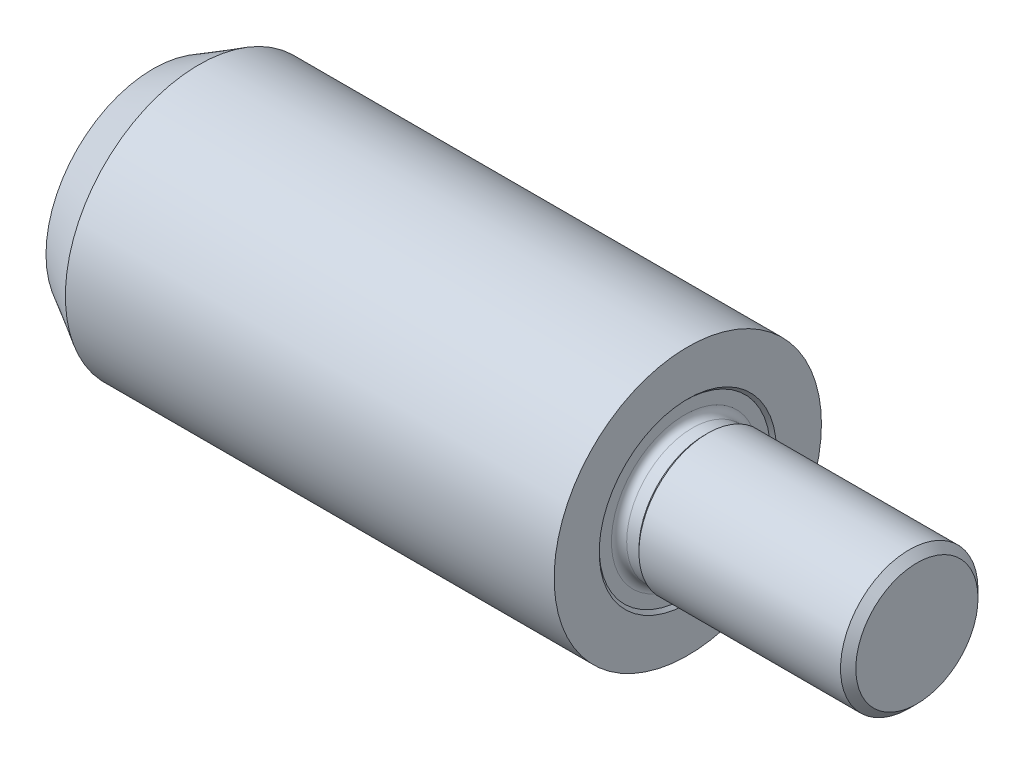
from build123d import *

# Parameters (mm, degrees)
CHAMFER_1_SIZE = 1
SKETCH_4_W     = 3
SKETCH_4_H     = 3
FILLET_1_R     = 1
CHAMFER_2_SIZE = 0.4


with BuildPart() as part:
    # 草图3 → 旋转1 (revolve)
    with BuildSketch(Plane.XY, mode=Mode.PRIVATE) as revolve_1_sk:
        Polygon((0, 0), (0, 14.035898385), (6, 17.5), (70, 17.5), (70, 9), (100, 9), (100, 0), align=None)
    revolve(revolve_1_sk.sketch.rotate(Axis((100, 0, 0), (-1, 0, 0)), 90), axis=Axis((100, 0, 0), (-1, 0, 0)))

    # 倒角1
    chamfer_1_edges = [part.edges().sort_by_distance(p)[0] for p in [
        (100, 0, 9),
    ]]
    chamfer(chamfer_1_edges, length=CHAMFER_1_SIZE)

    # 草图4 → 切除-旋转1 (revolve, cut)
    with BuildSketch(Plane.XY, mode=Mode.PRIVATE) as cut_revolve_1_sk:
        with Locations((71.1, 10.1)):
            Rectangle(SKETCH_4_W, SKETCH_4_H)
    revolve(cut_revolve_1_sk.sketch.rotate(Axis((66.500454026, 0, 0), (1, 0, 0)), 90), axis=Axis((66.500454026, 0, 0), (1, 0, 0)), mode=Mode.SUBTRACT)

    # 圆角1
    fillet_1_edges = [part.edges().sort_by_distance(p)[0] for p in [
        (69.6, 0, -8.6),
    ]]
    fillet(fillet_1_edges, radius=FILLET_1_R)

    # 倒角2
    chamfer_2_edges = [part.edges().sort_by_distance(p)[0] for p in [
        (72.6, 0, -8.6),
        (69.6, 0, -11.6),
    ]]
    chamfer(chamfer_2_edges, length=CHAMFER_2_SIZE - 0.0001)  # a hair under: the kernel refuses the full size


solid = part.part
